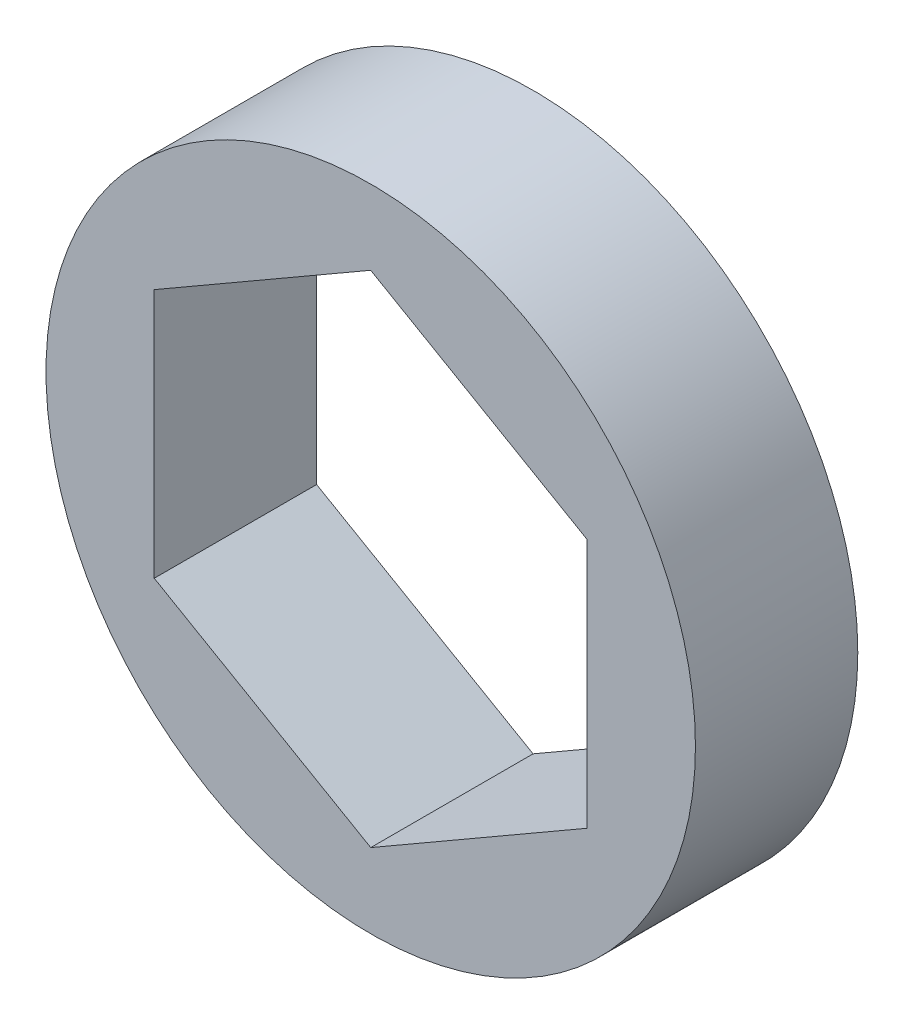
from build123d import *

# Parameters (mm, degrees)
SKETCH2_R           = 9.525
BOSS_EXTRUDE1_DEPTH = 4.7625


with BuildPart() as part:
    # Sketch2 → Boss-Extrude1 (new body)
    with BuildSketch(Plane.XY):
        Circle(SKETCH2_R)
        Polygon((0, 7.332348419), (-6.35, 3.666174209), (-6.35, -3.666174209), (0, -7.332348419), (6.35, -3.666174209), (6.35, 3.666174209), align=None, mode=Mode.SUBTRACT)
    extrude(amount=BOSS_EXTRUDE1_DEPTH)


solid = part.part
